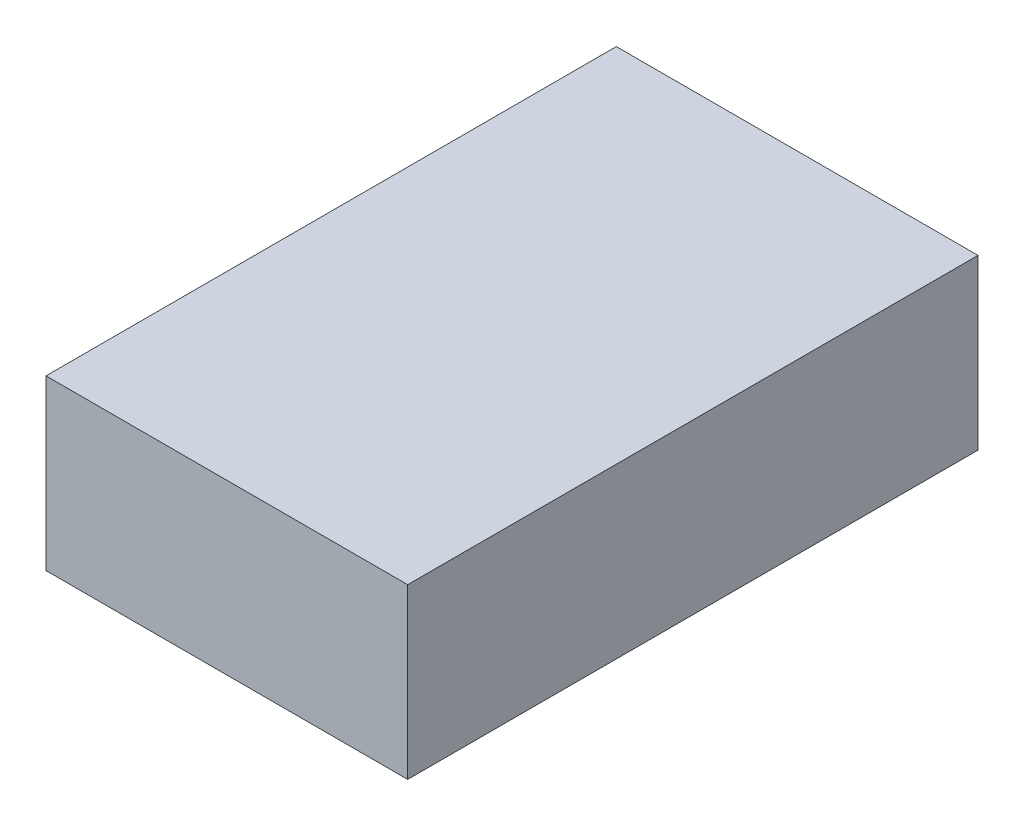
from build123d import *

# Parameters (mm, degrees)
SKETCH1_W           = 66.04
SKETCH1_H           = 104.14
BOSS_EXTRUDE1_DEPTH = 30.7975


with BuildPart() as part:
    # Sketch1 → Boss-Extrude1 (new body)
    with BuildSketch(Plane(origin=(0, 0, 0), x_dir=(1, 0, 0), z_dir=(0, 1, 0))):
        Rectangle(SKETCH1_W, SKETCH1_H)
    extrude(amount=BOSS_EXTRUDE1_DEPTH)


solid = part.part
